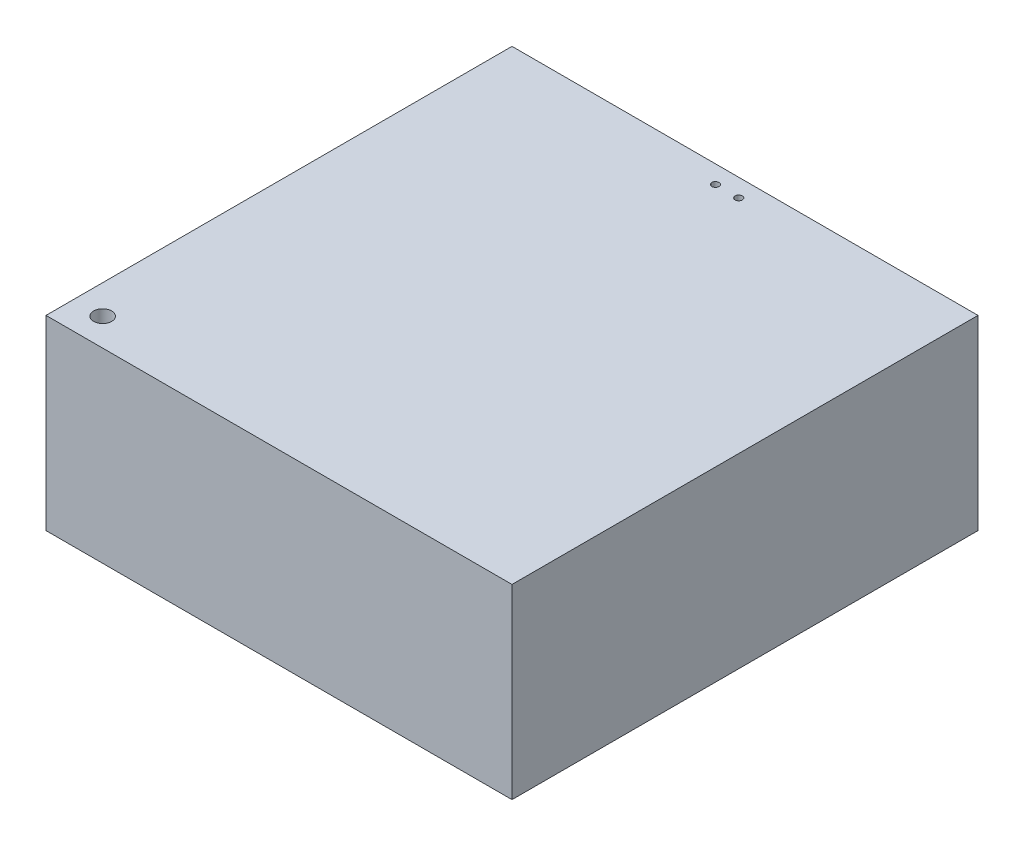
from build123d import *

# Parameters (mm, degrees)
SKETCH1_W           = 130
SKETCH1_H           = 130
BOSS_EXTRUDE1_DEPTH = 52
SKETCH2_R           = 2.527235636
CUT_EXTRUDE1_DEPTH  = 10
SKETCH5_R           = 1
CUT_EXTRUDE3_DEPTH  = 5


with BuildPart() as part:
    # Sketch1 → Boss-Extrude1 (new body)
    with BuildSketch(Plane(origin=(0, 0, 0), x_dir=(1, 0, 0), z_dir=(0, 1, 0))):
        Rectangle(SKETCH1_W, SKETCH1_H)
    extrude(amount=BOSS_EXTRUDE1_DEPTH)

    # Sketch2 → Cut-Extrude1 (cut)
    with BuildSketch(Plane(origin=(0, 52, 0), x_dir=(1, 0, 0), z_dir=(0, 1, 0))):
        with Locations((-56.907861824, -57.290089516)):
            Circle(SKETCH2_R)
    extrude(amount=-CUT_EXTRUDE1_DEPTH, mode=Mode.SUBTRACT)

    # Sketch5 → Cut-Extrude3 (cut)
    with BuildSketch(Plane(origin=(0, 52, 0), x_dir=(1, 0, 0), z_dir=(0, 1, 0))):
        with Locations((-3.25, 60)):
            Circle(SKETCH5_R)
        with Locations((3.25, 60)):
            Circle(SKETCH5_R)
    extrude(amount=-CUT_EXTRUDE3_DEPTH, mode=Mode.SUBTRACT)


solid = part.part
